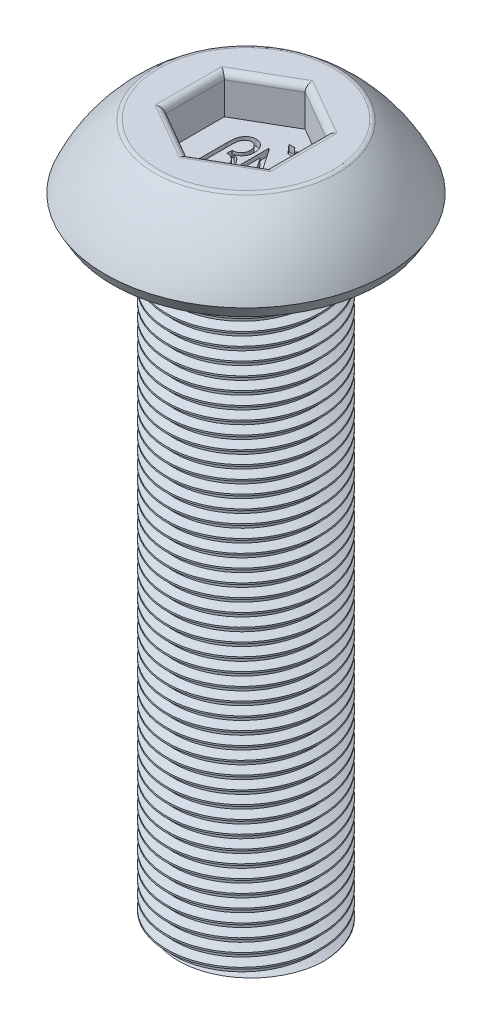
from build123d import *

# Parameters (mm, degrees)
CUT_EXTRUDE1_DEPTH = 0.75
FILLET1_R          = 0.125
WRAP1_START        = -0.125
WRAP1_DEPTH        = 0.125
THREAD1_PITCH      = 0.25


with BuildPart() as part:
    # Sketch1 → Revolve1 (revolve)
    with BuildSketch(Plane(origin=(0, 0, 0), x_dir=(0, 0, -1), z_dir=(1, 0, 0)), mode=Mode.PRIVATE) as revolve1_sk:
        with BuildLine():
            Line((0, 1.5), (-1.75, 1.5))
            ThreePointArc((-1.75, 1.5), (-2.334912942, 0.942930354), (-2.75, 0.25))
            Line((-2.75, 0.25), (-2.605662433, 0))
            Line((-2.605662433, 0), (-1.5, 0))
            Line((-1.5, 0), (-1.5, -12))
            Line((-1.5, -12), (0, -12))
            Line((0, -12), (0, 1.5))
        make_face()
    revolve(revolve1_sk.sketch.rotate(Axis((0, -12, 0), (0, 1, 0)), 180), axis=Axis((0, -12, 0), (0, 1, 0)))

    # Sketch2 → Cut-Extrude1 (cut)
    with BuildSketch(Plane(origin=(0, 1.5, 0), x_dir=(1, 0, 0), z_dir=(0, 1, 0))):
        Polygon((0, 1.154700538), (-1, 0.577350269), (-1, -0.577350269), (0, -1.154700538), (1, -0.577350269), (1, 0.577350269), align=None)
    extrude(amount=-CUT_EXTRUDE1_DEPTH, mode=Mode.SUBTRACT)

    # Fillet1
    fillet1_edges = [part.edges().sort_by_distance(p)[0] for p in [
        (0.5, 1.5, -0.866025404),
        (-0.5, 1.5, -0.866025404),
        (-1, 1.5, 0),
        (-0.5, 1.5, 0.866025404),
        (0.5, 1.5, 0.866025404),
        (1, 1.5, 0),
        (0, 1.5, 1.75),
    ]]
    fillet(fillet1_edges, radius=FILLET1_R)

    # Wrap1: read off the stored shape, not the designer's step
    # Wrap1 outline → Wrap1 (cut)
    with BuildSketch(Plane(origin=(0, 0.75, 0), x_dir=(1, 0, 0), z_dir=(0, 1, 0)).offset(WRAP1_START)):
        with BuildLine():
            add(Edge.make_bspline(
                [(-0.537455829, 0.145072229), (-0.537366548, 0.15735919), (-0.537194747, 0.181002472), (-0.536236546, 0.215136123), (-0.534510696, 0.246473554), (-0.531857696, 0.275057496), (-0.528751002, 0.300937263), (-0.524861231, 0.324098842), (-0.520025531, 0.344486675), (-0.512963856, 0.367808475), (-0.501673714, 0.39403328), (-0.484042302, 0.422215735), (-0.462961845, 0.447719467), (-0.43819726, 0.469796385), (-0.410438674, 0.48826361), (-0.379753396, 0.501330341), (-0.346770262, 0.509472114), (-0.323962243, 0.510388658), (-0.312295573, 0.510857485)],
                knots=[0, 0, 0, 0, 0.075666503, 0.145601872, 0.210267314, 0.268902852, 0.322354979, 0.370758742, 0.413447068, 0.451298193, 0.520734923, 0.588514213, 0.655379256, 0.723813985, 0.792131248, 0.85973193, 0.928250616, 1, 1, 1, 1], degree=3))
            Line((-0.537455829, 0.145072229), (-0.537455829, -0.527604053))
            Line((-0.537455829, -0.527604053), (-0.460532752, -0.527604053))
            Line((-0.460532752, -0.527604053), (-0.460532752, 0.137460049))
            add(Edge.make_bspline(
                [(-0.447712239, 0.305328639), (-0.448774545, 0.301469619), (-0.451134212, 0.292897693), (-0.453525545, 0.278533298), (-0.455753975, 0.261566558), (-0.457491806, 0.241915402), (-0.458861613, 0.219538201), (-0.459832928, 0.194491685), (-0.460431178, 0.166843342), (-0.460497896, 0.147543183), (-0.460532752, 0.137460049)],
                knots=[0, 0, 0, 0, 0.071102967, 0.157938928, 0.258486703, 0.375288845, 0.508476997, 0.656953648, 0.820779591, 1, 1, 1, 1], degree=3))
            add(Edge.make_bspline(
                [(-0.310292367, 0.421113895), (-0.317674297, 0.420714803), (-0.332400851, 0.419918636), (-0.353965955, 0.413875353), (-0.374511474, 0.403804365), (-0.393760239, 0.390026559), (-0.411220155, 0.372905819), (-0.426330799, 0.352966004), (-0.438683838, 0.330213781), (-0.444651659, 0.313764569), (-0.447712239, 0.305328639)],
                knots=[0, 0, 0, 0, 0.115143072, 0.229704239, 0.346728965, 0.47082069, 0.597615275, 0.727089869, 0.860038825, 1, 1, 1, 1], degree=3))
            add(Edge.make_bspline(
                [(-0.17848147, 0.261057806), (-0.178952566, 0.271974178), (-0.179864172, 0.293098195), (-0.186637459, 0.323530756), (-0.198777604, 0.350930356), (-0.212261145, 0.371485038), (-0.225066026, 0.38586534), (-0.235235588, 0.395399384), (-0.246252738, 0.403200746), (-0.257654824, 0.410013084), (-0.269995595, 0.414921405), (-0.282862679, 0.418632696), (-0.296413152, 0.420560449), (-0.305613195, 0.420927309), (-0.310292367, 0.421113895)],
                knots=[0, 0, 0, 0, 0.141583044, 0.273974039, 0.401600231, 0.528456794, 0.591043942, 0.651122908, 0.708825408, 0.765880537, 0.822988251, 0.880580103, 0.939262648, 1, 1, 1, 1], degree=3))
            add(Edge.make_bspline(
                [(-0.340941406, 0.087780562), (-0.334988303, 0.08792105), (-0.323299062, 0.088196907), (-0.306225523, 0.090764835), (-0.289888322, 0.094368098), (-0.274654087, 0.100137271), (-0.260174408, 0.107124777), (-0.24682212, 0.11601785), (-0.234254323, 0.126336142), (-0.222711003, 0.138095802), (-0.212416341, 0.151054166), (-0.203323514, 0.164708223), (-0.195692258, 0.179095557), (-0.189162431, 0.194099224), (-0.184457799, 0.209936522), (-0.181072867, 0.226359939), (-0.178698712, 0.243427453), (-0.178554801, 0.255106579), (-0.17848147, 0.261057806)],
                knots=[0, 0, 0, 0, 0.067065692, 0.131687113, 0.194317921, 0.255289037, 0.314878218, 0.375218702, 0.435653028, 0.497934511, 0.56059698, 0.621980302, 0.682601877, 0.743985199, 0.806139168, 0.868443394, 0.932963888, 1, 1, 1, 1], degree=3))
            Line((-0.340941406, 0.087780562), (-0.357968649, 0.087780562))
            Line((-0.357968649, 0.087780562), (-0.357968649, -0.014783541))
            add(Edge.make_bspline(
                [(-0.152840444, -0.246153733), (-0.152991921, -0.237935238), (-0.153288163, -0.221862292), (-0.155672785, -0.198335348), (-0.159894598, -0.176034257), (-0.165736265, -0.154867378), (-0.173053307, -0.13483662), (-0.182215246, -0.116043494), (-0.192787882, -0.098300128), (-0.20519576, -0.081953022), (-0.21910276, -0.067000398), (-0.234429011, -0.053697294), (-0.25160782, -0.04265632), (-0.269991613, -0.033131715), (-0.29004854, -0.025867397), (-0.311286964, -0.019869429), (-0.334167811, -0.016416131), (-0.349879854, -0.015338382), (-0.357968649, -0.014783541)],
                knots=[0, 0, 0, 0, 0.070899124, 0.138657723, 0.203740428, 0.266496883, 0.327925022, 0.387445969, 0.44662859, 0.505853257, 0.564143059, 0.622569358, 0.680413321, 0.739931479, 0.800819634, 0.864131594, 0.930052902, 1, 1, 1, 1], degree=3))
            add(Edge.make_bspline(
                [(-0.309891726, -0.450680977), (-0.304334961, -0.450571211), (-0.293413044, -0.450355466), (-0.277514036, -0.447340483), (-0.262286727, -0.442989313), (-0.247781817, -0.436676481), (-0.233907442, -0.428733085), (-0.221051475, -0.418678171), (-0.208664071, -0.407189838), (-0.197187775, -0.393882067), (-0.186871623, -0.37903336), (-0.17755536, -0.363253667), (-0.169907305, -0.346235338), (-0.163848892, -0.328206631), (-0.158625475, -0.30926113), (-0.155449196, -0.289102842), (-0.15305503, -0.26797937), (-0.152912733, -0.253506267), (-0.152840444, -0.246153733)],
                knots=[0, 0, 0, 0, 0.057830355, 0.113666545, 0.168061557, 0.222616608, 0.278122197, 0.334218011, 0.392319921, 0.453992458, 0.516935927, 0.58055674, 0.644719566, 0.710965936, 0.778658745, 0.849251577, 0.923417744, 1, 1, 1, 1], degree=3))
            add(Edge.make_bspline(
                [(-0.409250701, -0.417427771), (-0.40035509, -0.422552084), (-0.383473121, -0.432276934), (-0.357561529, -0.44229785), (-0.333383308, -0.449497533), (-0.317482442, -0.450298576), (-0.309891726, -0.450680977)],
                knots=[0, 0, 0, 0, 0.290177362, 0.550694617, 0.785511707, 1, 1, 1, 1], degree=3))
            Line((-0.409250701, -0.417427771), (-0.409250701, -0.507371682))
            add(Edge.make_bspline(
                [(-0.298273137, -0.540424566), (-0.308861639, -0.540097242), (-0.329301798, -0.539465371), (-0.358664913, -0.532954409), (-0.385682425, -0.522833546), (-0.401463988, -0.512480121), (-0.409250701, -0.507371682)],
                knots=[0, 0, 0, 0, 0.269471748, 0.52019112, 0.763259579, 1, 1, 1, 1], degree=3))
            add(Edge.make_bspline(
                [(-0.075917367, -0.249759502), (-0.076128163, -0.26018073), (-0.076541077, -0.280594276), (-0.079227651, -0.310491914), (-0.084396107, -0.33890103), (-0.091033777, -0.365960134), (-0.09992887, -0.391457717), (-0.110563094, -0.41559927), (-0.123397597, -0.438155636), (-0.137962217, -0.459132621), (-0.153934421, -0.478163377), (-0.171095941, -0.494958486), (-0.189740067, -0.508821331), (-0.209271063, -0.520337979), (-0.2298646, -0.529505832), (-0.251686582, -0.535889962), (-0.274626983, -0.539804561), (-0.290311376, -0.540215808), (-0.298273137, -0.540424566)],
                knots=[0, 0, 0, 0, 0.076485505, 0.149823073, 0.219996399, 0.288217649, 0.354082023, 0.417919027, 0.481558234, 0.544225908, 0.605087621, 0.663657146, 0.720011753, 0.77514507, 0.829777395, 0.884976008, 0.941611157, 1, 1, 1, 1], degree=3))
            add(Edge.make_bspline(
                [(-0.194707432, 0.00885428), (-0.185532098, 0.002246917), (-0.167142487, -0.010995852), (-0.14356067, -0.035865532), (-0.123015599, -0.064046821), (-0.106173919, -0.095826321), (-0.092429948, -0.130510752), (-0.082995533, -0.168026939), (-0.077008082, -0.208034101), (-0.076287996, -0.23558107), (-0.075917367, -0.249759502)],
                knots=[0, 0, 0, 0, 0.114174048, 0.228832702, 0.344903554, 0.466103946, 0.591676048, 0.72144281, 0.856626542, 1, 1, 1, 1], degree=3))
            add(Edge.make_bspline(
                [(-0.273032752, 0.036899152), (-0.264977593, 0.035253476), (-0.249714467, 0.032135208), (-0.228666305, 0.025295577), (-0.210172583, 0.018341569), (-0.199638474, 0.011879289), (-0.194707432, 0.00885428)],
                knots=[0, 0, 0, 0, 0.294434237, 0.557901696, 0.79305271, 1, 1, 1, 1], degree=3))
            add(Edge.make_bspline(
                [(-0.200917367, 0.061939216), (-0.205600715, 0.059219735), (-0.215469689, 0.053489114), (-0.232413767, 0.046806913), (-0.251771921, 0.040993346), (-0.265723651, 0.038306664), (-0.273032752, 0.036899152)],
                knots=[0, 0, 0, 0, 0.211315364, 0.445293882, 0.709397831, 1, 1, 1, 1], degree=3))
            add(Edge.make_bspline(
                [(-0.101558393, 0.265064216), (-0.101829728, 0.254158186), (-0.102360461, 0.23282596), (-0.107582885, 0.201794643), (-0.115635878, 0.172523389), (-0.127393107, 0.145424978), (-0.141807851, 0.120566799), (-0.158666737, 0.09801557), (-0.178511599, 0.078390972), (-0.193428545, 0.067437991), (-0.200917367, 0.061939216)],
                knots=[0, 0, 0, 0, 0.138734507, 0.271365083, 0.399463796, 0.524371928, 0.64626696, 0.764603187, 0.881822663, 1, 1, 1, 1], degree=3))
            add(Edge.make_bspline(
                [(-0.312295573, 0.510857485), (-0.304601721, 0.510709635), (-0.289468193, 0.510418818), (-0.267407867, 0.506806308), (-0.246411552, 0.501505665), (-0.226632783, 0.49383833), (-0.208041676, 0.483900131), (-0.190537128, 0.47184286), (-0.174217748, 0.457507541), (-0.159329374, 0.44106616), (-0.145724285, 0.423136003), (-0.133914037, 0.403846519), (-0.123827558, 0.383480477), (-0.115525112, 0.361982783), (-0.109489008, 0.339238969), (-0.104721569, 0.315513437), (-0.102229905, 0.290624502), (-0.101784813, 0.273682609), (-0.101558393, 0.265064216)],
                knots=[0, 0, 0, 0, 0.063537388, 0.124975739, 0.184284437, 0.242302503, 0.299838056, 0.35817297, 0.417627897, 0.478966986, 0.541230446, 0.60342781, 0.66563497, 0.728883988, 0.793562004, 0.859921094, 0.928741429, 1, 1, 1, 1], degree=3))
        make_face()
        Polygon((0.565629107, -0.527604053), (0.583056992, -0.527604053), (0.583056992, 0.472395947), (0.506133915, 0.472395947), (0.506133915, -0.290224246), (-0.016101662, 0.472395947), (-0.032327624, 0.472395947), (-0.032327624, -0.527604053), (0.044595453, -0.527604053), (0.044595453, 0.233012934), align=None)
        Polygon((0.095877504, 0.741626716), (0.244315004, 0.574960049), (0.318633915, 0.574960049), (0.467672376, 0.741626716), (0.350885517, 0.741626716), (0.280172376, 0.662700434), (0.212664363, 0.741626716), align=None)
    extrude(amount=WRAP1_DEPTH, mode=Mode.SUBTRACT)

    # Thread1: arcs per turn and ends read off the stored shape
    # Thread1: the profile of Thread Profile1 profile screwed along a right-hand helix through 51 turns, 6 arcs to a turn; built about Z, then put on its axis
    thread1_z = Axis((0, 0, 0), (0, 0, 1))
    thread1_corners = [(1.5003, 0, -0.000173205), (1.5003, 0, 0.218923204), (1.364683531, 0, 0.140625), (1.364683531, 0, 0.078125)]
    with BuildLine(mode=Mode.PRIVATE) as thread1_profile:
        Line(thread1_corners[0], thread1_corners[1])
        Line(thread1_corners[1], thread1_corners[2])
        Line(thread1_corners[2], thread1_corners[3])
        Line(thread1_corners[3], thread1_corners[0])
    thread1_cap = Face(thread1_profile.wire())
    thread1_turn_angles = [0, 30, 60, 90, 120, 150, 180, 210, 240, 270, 300, 330, 360]
    thread1_turn_weights = [1, 0.8660254037844387, 1, 0.8660254037844387, 1, 0.8660254037844387, 1, 0.8660254037844387, 1, 0.8660254037844387, 1, 0.8660254037844387, 1]
    thread1_turn_rails = [Edge.make_bspline([Vector(p[0], p[1], 0).rotate(thread1_z, thread1_turn_angles[k]) / thread1_turn_weights[k] + Vector(0, 0, p[2] + THREAD1_PITCH * thread1_turn_angles[k] / 360) for k in range(13)], [0, 0, 0, 1, 1, 2, 2, 3, 3, 4, 4, 5, 5, 6, 6, 6], 2, thread1_turn_weights) for p in thread1_corners]
    thread1_turn_sides = [Face.make_surface_from_curves(thread1_turn_rails[p[0]], thread1_turn_rails[p[1]]) for p in [(0, 1), (1, 2), (2, 3), (3, 0)]]
    thread1 = Plane(origin=(0, -13, 0), x_dir=(1, 0, 0), z_dir=(0, 1, 0)) * Solid(Shell([*[p.moved(Location((0, 0, THREAD1_PITCH * i))) for i in range(51) for p in thread1_turn_sides], thread1_cap, thread1_cap.rotate(thread1_z, 18360).moved(Location((0, 0, THREAD1_PITCH * 18360 / 360)))]))
    add(thread1, mode=Mode.SUBTRACT)


solid = part.part
